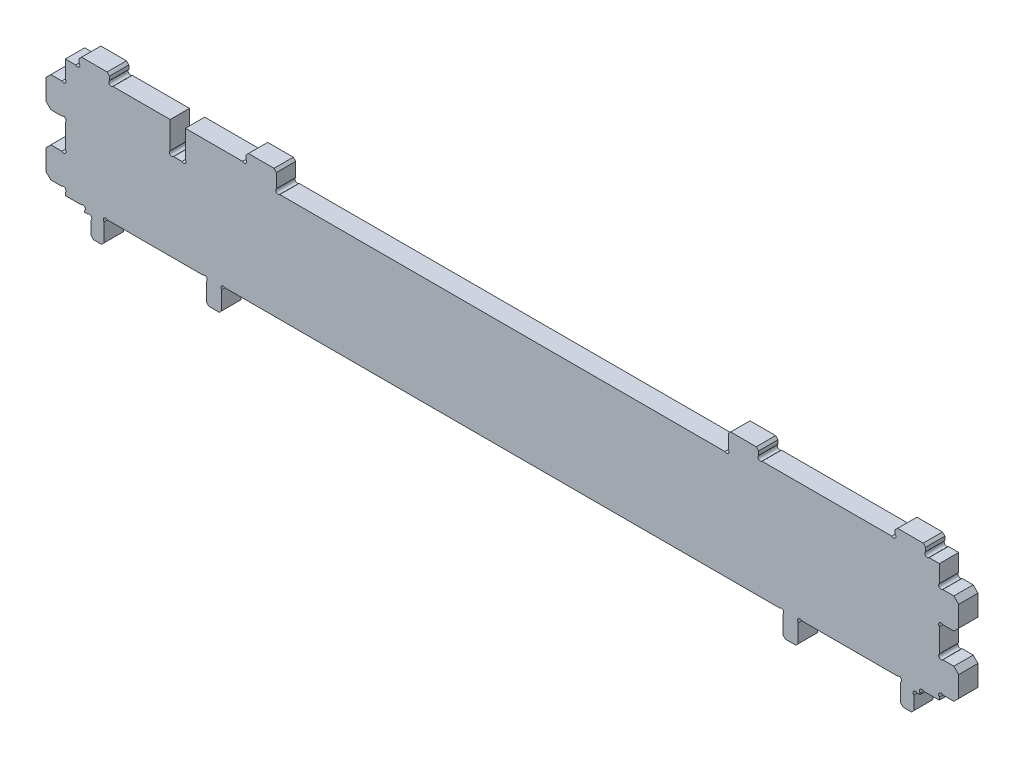
from build123d import *

# Parameters (mm, degrees)
BOSS_EXTRUDE1_DEPTH = 6.35
CHAMFER1_SIZE       = 0.79375
CHAMFER2_SIZE       = 1.5875


with BuildPart() as part:
    # Sketch1 → Boss-Extrude1 (new body)
    with BuildSketch(Plane.XY):
        with BuildLine():
            Line((134.621545702, -67.612541882), (134.621545702, -60.810273898))
            ThreePointArc((134.621545702, -60.810273898), (134.621545702, -59.687741882), (133.499013687, -59.687741882))
            Line((133.499013687, -59.687741882), (102.049077718, -59.687741882))
            ThreePointArc((102.049077718, -59.687741882), (100.926545702, -59.687741882), (100.926545702, -60.810273898))
            Line((100.926545702, -60.810273898), (100.926545702, -67.612541882))
            Line((100.926545702, -67.612541882), (95.926545702, -67.612541882))
            Line((95.926545702, -67.612541882), (95.926545702, -60.810273898))
            ThreePointArc((95.926545702, -60.810273898), (95.926545702, -59.687741882), (94.804013687, -59.687741882))
            Line((94.804013687, -59.687741882), (-87.460922281, -59.687741882))
            ThreePointArc((-87.460922281, -59.687741882), (-88.583454296, -59.687741882), (-88.583454296, -60.810273898))
            Line((-88.583454296, -60.810273898), (-88.583454296, -67.612541882))
            Line((-88.583454296, -67.612541882), (-93.583454296, -67.612541882))
            Line((-93.583454296, -67.612541882), (-93.583454296, -60.810273898))
            ThreePointArc((-93.583454296, -60.810273898), (-93.583454296, -59.687741882), (-94.705986312, -59.687741882))
            Line((-94.705986312, -59.687741882), (-126.155922281, -59.687741882))
            ThreePointArc((-126.155922281, -59.687741882), (-127.278454296, -59.687741882), (-127.278454296, -60.810273898))
            Line((-127.278454296, -60.810273898), (-127.278454296, -67.612541882))
            Line((-127.278454296, -67.612541882), (-131.507694323, -67.612541882))
            Line((-131.507694323, -67.612541882), (-131.507694323, -62.385073898))
            ThreePointArc((-131.507694323, -62.385073898), (-131.507694323, -61.262541882), (-132.630226338, -61.262541882))
            Line((-132.630226338, -61.262541882), (-133.628454296, -61.262541882))
            Line((-133.628454296, -61.262541882), (-133.628454296, -60.810273898))
            ThreePointArc((-133.628454296, -60.810273898), (-133.628454296, -59.687741882), (-134.750986312, -59.687741882))
            Line((-134.750986312, -59.687741882), (-139.978454296, -59.687741882))
            Line((-139.978454296, -59.687741882), (-139.978454296, -58.735073898))
            ThreePointArc((-139.978454296, -58.735073898), (-139.978454296, -57.612541882), (-141.100986312, -57.612541882))
            Line((-141.100986312, -57.612541882), (-146.328454296, -57.612541882))
            Line((-146.328454296, -57.612541882), (-146.328454296, -47.612541882))
            Line((-146.328454296, -47.612541882), (-141.100986312, -47.612541882))
            ThreePointArc((-141.100986312, -47.612541882), (-139.978454296, -47.612541882), (-139.978454296, -46.490009867))
            Line((-139.978454296, -46.490009867), (-139.978454296, -38.735073898))
            ThreePointArc((-139.978454296, -38.735073898), (-139.978454296, -37.612541882), (-141.100986312, -37.612541882))
            Line((-141.100986312, -37.612541882), (-146.328454296, -37.612541882))
            Line((-146.328454296, -37.612541882), (-146.328454296, -27.612541882))
            Line((-146.328454296, -27.612541882), (-141.100986312, -27.612541882))
            ThreePointArc((-141.100986312, -27.612541882), (-139.978454296, -27.612541882), (-139.978454296, -26.490009867))
            Line((-139.978454296, -26.490009867), (-139.978454296, -20.787541882))
            Line((-139.978454296, -20.787541882), (-136.575986312, -20.787541882))
            ThreePointArc((-136.575986312, -20.787541882), (-135.453454296, -20.787541882), (-135.453454296, -19.665009867))
            Line((-135.453454296, -19.665009867), (-135.453454296, -17.612541882))
            Line((-135.453454296, -17.612541882), (-125.453454296, -17.612541882))
            Line((-125.453454296, -17.612541882), (-125.453454296, -19.665009867))
            ThreePointArc((-125.453454296, -19.665009867), (-125.453454296, -20.787541882), (-124.330922281, -20.787541882))
            Line((-124.330922281, -20.787541882), (-105.521454296, -20.787541882))
            Line((-105.521454296, -20.787541882), (-105.521454296, -29.665009867))
            ThreePointArc((-105.521454296, -29.665009867), (-105.521454296, -30.787541882), (-104.398922281, -30.787541882))
            Line((-104.398922281, -30.787541882), (-101.643986312, -30.787541882))
            ThreePointArc((-101.643986312, -30.787541882), (-100.521454296, -30.787541882), (-100.521454296, -29.665009867))
            Line((-100.521454296, -29.665009867), (-100.521454296, -20.787541882))
            Line((-100.521454296, -20.787541882), (-81.711986312, -20.787541882))
            ThreePointArc((-81.711986312, -20.787541882), (-80.589454296, -20.787541882), (-80.589454296, -19.665009867))
            Line((-80.589454296, -19.665009867), (-80.589454296, -17.612541882))
            Line((-80.589454296, -17.612541882), (-70.589454296, -17.612541882))
            Line((-70.589454296, -17.612541882), (-70.589454296, -23.005209867))
            ThreePointArc((-70.589454296, -23.005209867), (-70.589454296, -24.127741882), (-69.466922281, -24.127741882))
            Line((-69.466922281, -24.127741882), (76.810013687, -24.127741882))
            ThreePointArc((76.810013687, -24.127741882), (77.932545702, -24.127741882), (77.932545702, -23.005209867))
            Line((77.932545702, -23.005209867), (77.932545702, -17.612541882))
            Line((77.932545702, -17.612541882), (87.932545702, -17.612541882))
            Line((87.932545702, -17.612541882), (87.932545702, -19.665009867))
            ThreePointArc((87.932545702, -19.665009867), (87.932545702, -20.787541882), (89.055077718, -20.787541882))
            Line((89.055077718, -20.787541882), (131.674013687, -20.787541882))
            ThreePointArc((131.674013687, -20.787541882), (132.796545702, -20.787541882), (132.796545702, -19.665009867))
            Line((132.796545702, -19.665009867), (132.796545702, -17.612541882))
            Line((132.796545702, -17.612541882), (142.796545702, -17.612541882))
            Line((142.796545702, -17.612541882), (142.796545702, -19.665009867))
            ThreePointArc((142.796545702, -19.665009867), (142.796545702, -20.787541882), (143.919077718, -20.787541882))
            Line((143.919077718, -20.787541882), (147.321545702, -20.787541882))
            Line((147.321545702, -20.787541882), (147.321545702, -26.490009867))
            ThreePointArc((147.321545702, -26.490009867), (147.321545702, -27.612541882), (148.444077718, -27.612541882))
            Line((148.444077718, -27.612541882), (153.671545702, -27.612541882))
            Line((153.671545702, -27.612541882), (153.671545702, -37.612541882))
            Line((153.671545702, -37.612541882), (148.444077718, -37.612541882))
            ThreePointArc((148.444077718, -37.612541882), (147.321545702, -37.612541882), (147.321545702, -38.735073898))
            Line((147.321545702, -38.735073898), (147.321545702, -46.490009867))
            ThreePointArc((147.321545702, -46.490009867), (147.321545702, -47.612541882), (148.444077718, -47.612541882))
            Line((148.444077718, -47.612541882), (153.671545702, -47.612541882))
            Line((153.671545702, -47.612541882), (153.671545702, -57.612541882))
            Line((153.671545702, -57.612541882), (148.444077718, -57.612541882))
            ThreePointArc((148.444077718, -57.612541882), (147.321545702, -57.612541882), (147.321545702, -58.735073898))
            Line((147.321545702, -58.735073898), (147.321545702, -59.687741882))
            Line((147.321545702, -59.687741882), (142.094077718, -59.687741882))
            ThreePointArc((142.094077718, -59.687741882), (140.971545702, -59.687741882), (140.971545702, -60.810273898))
            Line((140.971545702, -60.810273898), (140.971545702, -61.262541882))
            Line((140.971545702, -61.262541882), (140.071500685, -61.262541882))
            ThreePointArc((140.071500685, -61.262541882), (138.948968669, -61.262541882), (138.948968669, -62.385073898))
            Line((138.948968669, -62.385073898), (138.948968669, -67.612541882))
            Line((138.948968669, -67.612541882), (134.621545702, -67.612541882))
        make_face()
    extrude(amount=BOSS_EXTRUDE1_DEPTH)

    # Chamfer1
    chamfer1_edges = [part.edges().sort_by_distance(p)[0] for p in [
        (-131.507694323, -67.612541882, 3.175),
        (-93.583454296, -67.612541882, 3.175),
        (-127.278454296, -67.612541882, 3.175),
        (-88.583454296, -67.612541882, 3.175),
        (100.926545702, -67.612541882, 3.175),
        (95.926545702, -67.612541882, 3.175),
        (134.621545702, -67.612541882, 3.175),
        (138.948968669, -67.612541882, 3.175),
        (132.796545702, -17.612541882, 3.175),
        (142.796545702, -17.612541882, 3.175),
        (87.932545702, -17.612541882, 3.175),
        (77.932545702, -17.612541882, 3.175),
        (-70.589454296, -17.612541882, 3.175),
        (-80.589454296, -17.612541882, 3.175),
        (-125.453454296, -17.612541882, 3.175),
        (-135.453454296, -17.612541882, 3.175),
    ]]
    chamfer(chamfer1_edges, length=CHAMFER1_SIZE)

    # Chamfer2
    chamfer2_edges = [part.edges().sort_by_distance(p)[0] for p in [
        (153.671545702, -57.612541882, 3.175),
        (153.671545702, -47.612541882, 3.175),
        (153.671545702, -37.612541882, 3.175),
        (153.671545702, -27.612541882, 3.175),
        (-146.328454296, -57.612541882, 3.175),
        (-146.328454296, -47.612541882, 3.175),
        (-146.328454296, -37.612541882, 3.175),
        (-146.328454296, -27.612541882, 3.175),
    ]]
    chamfer(chamfer2_edges, length=CHAMFER2_SIZE)


solid = part.part
